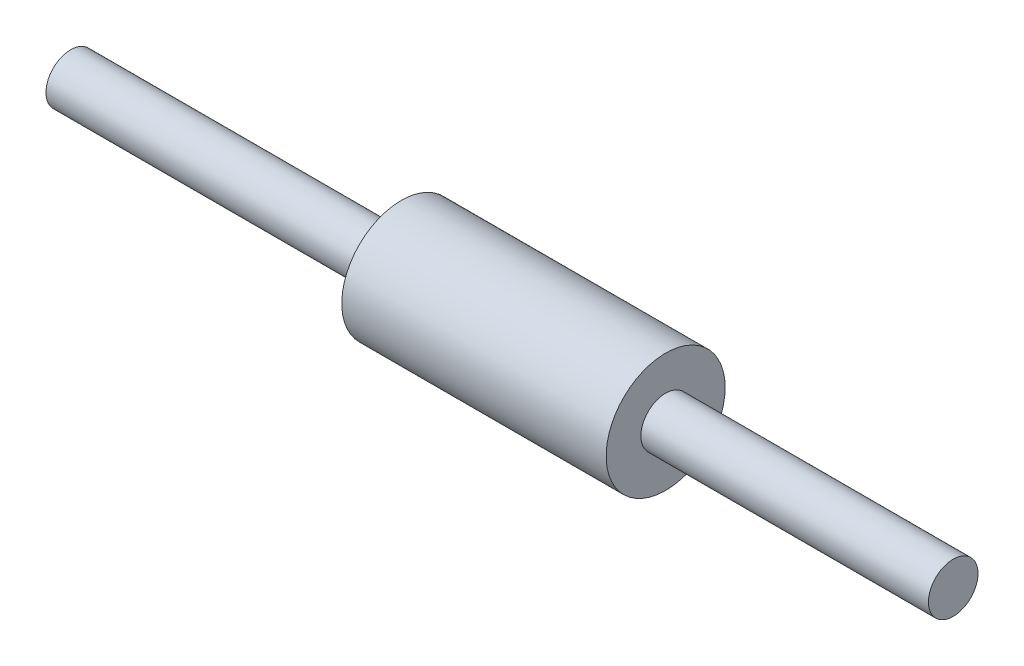
from build123d import *


with BuildPart() as part:
    # Sketch1 → Revolve1 (revolve)
    with BuildSketch(Plane.XY):
        Polygon((127, 0), (127, 7.5), (40, 7.5), (40, 18), (-40, 18), (-40, 7.5), (-140, 7.5), (-140, 6.5), (-127, 6.5), (-127, 0), align=None)
    revolve(axis=Axis((196.356223274, 0, 0), (-1, 0, 0)))


solid = part.part
